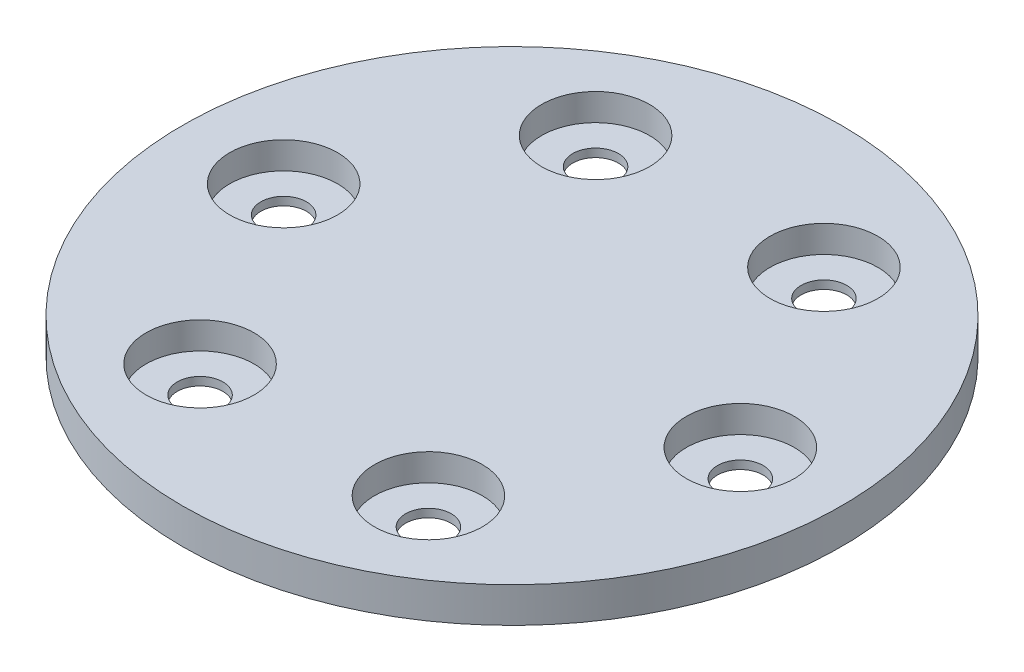
from build123d import *

# Parameters (mm, degrees)
SKETCH1_R           = 15.875
BOSS_EXTRUDE1_DEPTH = 1.7
CIRPATTERN1_COUNT   = 6


with BuildPart() as part:
    # Sketch1 → Boss-Extrude1 (new body)
    with BuildSketch(Plane(origin=(0, 0, 0), x_dir=(1, 0, 0), z_dir=(0, 1, 0))):
        Circle(SKETCH1_R)
    extrude(amount=BOSS_EXTRUDE1_DEPTH)

    # Sketch7 → CBORE for M5 Hex Head Bolt1 (revolve, cut)
    with BuildSketch(Plane(origin=(11, 1.7, 0), x_dir=(0, 0, 1), z_dir=(1, 0, 0))):
        Polygon((0, 0), (0, 5.660946681), (1.1, 5), (1.1, 1.3), (2.6, 1.3), (2.6, 0), align=None)
    cbore_for_m5_hex_head_bolt1 = revolve(axis=Axis((11, 8.05, 0), (0, -1, 0)), mode=Mode.SUBTRACT)

    # CirPattern1: CBORE for M5 Hex Head Bolt1 ×6 about axis
    cirpattern1_axis = Axis((0, 1.7, 0), (0, 1, 0))
    for i in range(1, CIRPATTERN1_COUNT):
        add(cbore_for_m5_hex_head_bolt1.rotate(cirpattern1_axis, i * 360 / CIRPATTERN1_COUNT), mode=Mode.SUBTRACT)


solid = part.part
